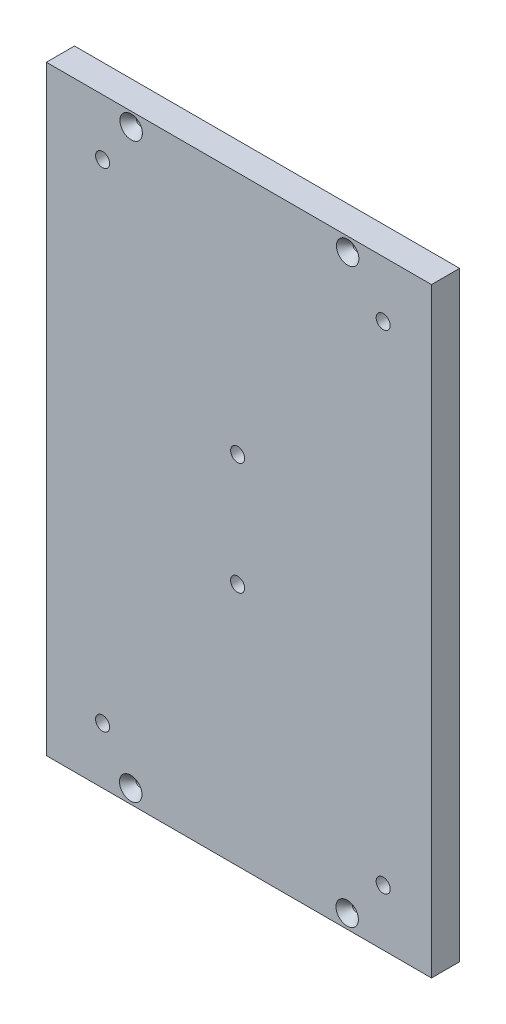
from build123d import *

# Parameters (mm, degrees)
SKETCH1_W                   = 174.021305966
SKETCH1_H                   = 271.365530146
BOSS_EXTRUDE1_DEPTH         = 12.7
F_1_4_0_25_DIAMETER_HOLE1_D = 6.35
HOLE1_D                     = 3.175
HOLE1_DEPTH                 = 31.75
HOLE1_CSINK_D               = 10.16
HOLE1_CSINK_ANGLE           = 82
HOLE1_TIP                   = 0.953866233


with BuildPart() as part:
    # Sketch1 → Boss-Extrude1 (new body)
    with BuildSketch(Plane.XY):
        with Locations((212.253144626, 135.682765073)):
            Rectangle(SKETCH1_W, SKETCH1_H)
    extrude(amount=BOSS_EXTRUDE1_DEPTH)

    # 1/4 (0.25) Diameter Hole1 (through all)
    with Locations(Plane(origin=(0, 0, 0), x_dir=(-1, 0, 0), z_dir=(0, 0, -1))):
        with Locations((-277.426568305, 245.965530146), (-211.653264176, 161.082765073), (-150.642491643, 245.965530146), (-211.653264176, 110.282765073), (-277.426568305, 25.4), (-150.642491643, 25.4)):
            Hole(F_1_4_0_25_DIAMETER_HOLE1_D / 2)

    # Hole1
    with Locations(Plane(origin=(-504.900458932, 135.816741379, 12.7), x_dir=(0, -1, 0), z_dir=(0, 0, 1))):
        with Locations((-129.257383629, 766.263727577), (129.466741379, 668.242950575), (129.466741379, 766.064256541), (-129.408220012, 668.442537903)):
            CounterSinkHole(HOLE1_D / 2, HOLE1_CSINK_D / 2, depth=HOLE1_DEPTH, counter_sink_angle=HOLE1_CSINK_ANGLE)
            with Locations((0, 0, -(HOLE1_DEPTH + HOLE1_TIP / 2))):  # 118° drill point
                Cone(0, HOLE1_D / 2, HOLE1_TIP, mode=Mode.SUBTRACT)


solid = part.part
